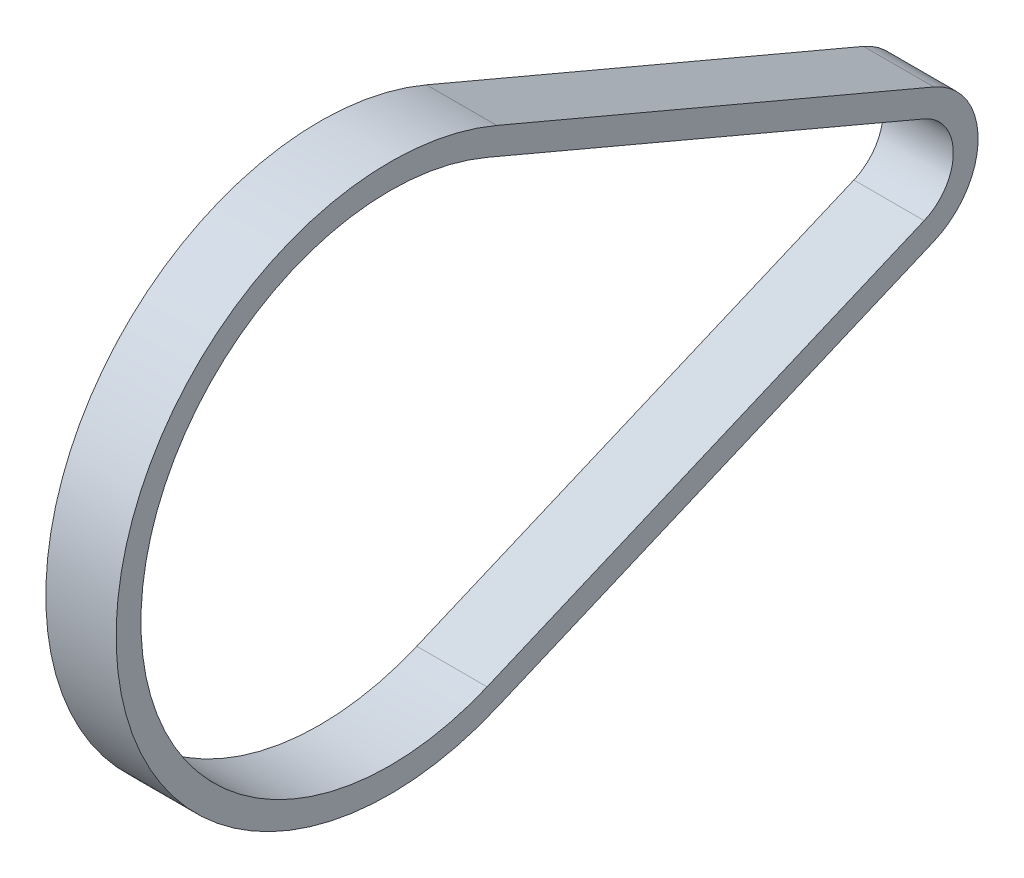
from build123d import *

# Parameters (mm, degrees)
BOSS_EXTRUDE1_DEPTH = 4.5


with BuildPart() as part:
    # Sketch1 → Boss-Extrude1 (new, symmetric)
    with BuildSketch(Plane(origin=(0, 0, 0), x_dir=(0, 0, -1), z_dir=(1, 0, 0))):
        with BuildLine():
            Line((13.674773982, 32.26898136), (69.617504649, 8.56187424))
            ThreePointArc((69.617504649, 8.56187424), (75.28814, 0), (69.617504649, -8.56187424))
            Line((69.617504649, -8.56187424), (13.674773982, -32.26898136))
            ThreePointArc((13.674773982, -32.26898136), (-35.04692, 0), (13.674773982, 32.26898136))
        make_face()
        with BuildLine():
            Line((12.435937376, 29.34564271), (68.378668044, 5.638535589))
            ThreePointArc((68.378668044, 5.638535589), (72.11314, 0), (68.378668044, -5.638535589))
            Line((68.378668044, -5.638535589), (12.435937376, -29.34564271))
            ThreePointArc((12.435937376, -29.34564271), (-31.87192, 0), (12.435937376, 29.34564271))
        make_face(mode=Mode.SUBTRACT)
    extrude(amount=BOSS_EXTRUDE1_DEPTH, both=True)


solid = part.part
